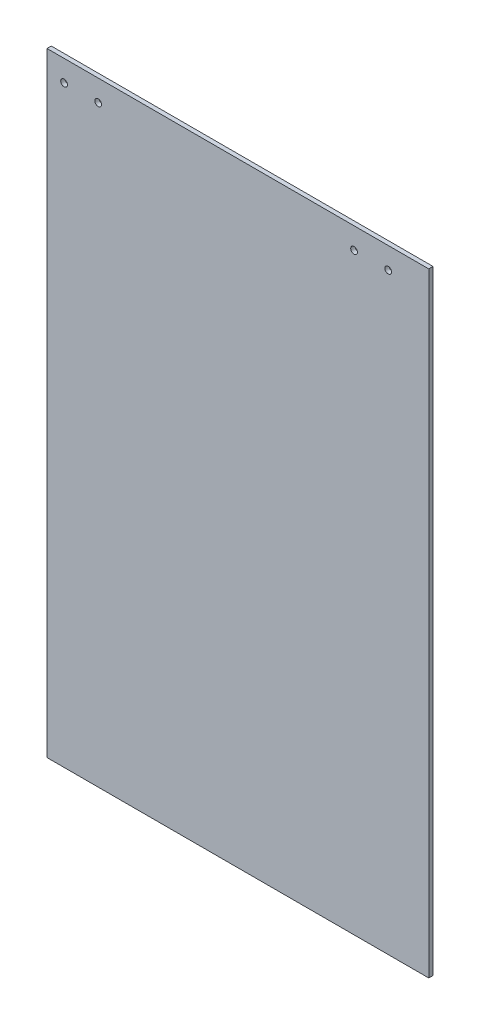
from build123d import *

# Parameters (mm, degrees)
SKETCH1_W                  = 457.2
SKETCH1_H                  = 284.226
BOSS_EXTRUDE1_DEPTH        = 3.175
F_9_0_196_DIAMETER_HOLE2_D = 4.9784


with BuildPart() as part:
    # Sketch1 → Boss-Extrude1 (new body)
    with BuildSketch(Plane(origin=(0, 0, 0), x_dir=(0, 1, 0), z_dir=(0, 0, 1))):
        Rectangle(SKETCH1_W, SKETCH1_H)
    extrude(amount=BOSS_EXTRUDE1_DEPTH)

    # #9 (0.196) Diameter Hole2 (through all)
    with Locations(Plane.XY.offset(3.175)):
        with Locations((-129.413, 212.725), (-104.013, 212.725), (86.487, 212.725), (111.887, 212.725)):
            Hole(F_9_0_196_DIAMETER_HOLE2_D / 2)


solid = part.part
